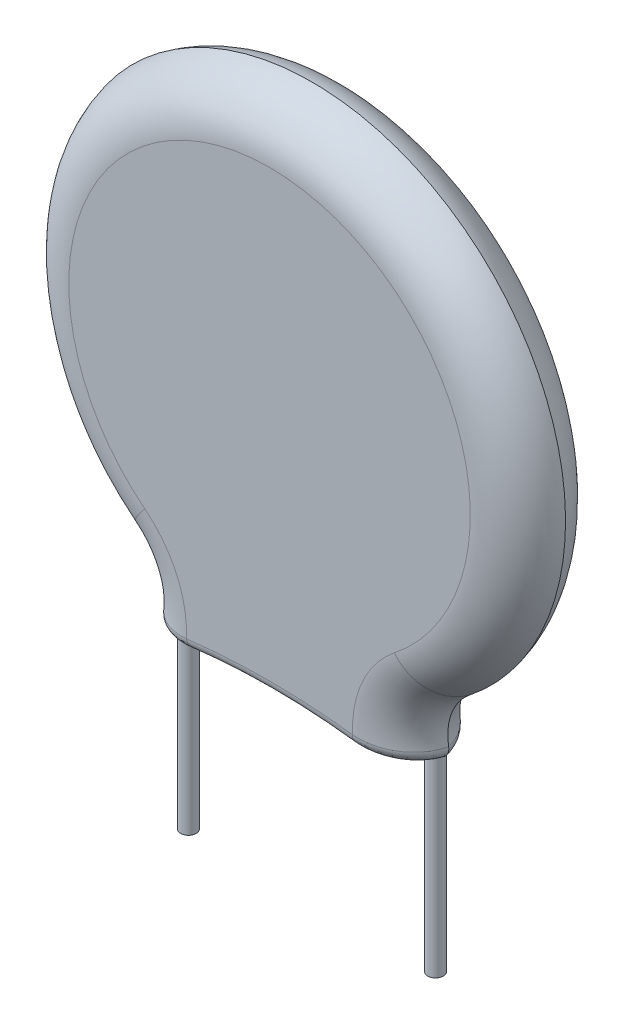
from build123d import *

# Parameters (mm, degrees)
BOSS_EXTRUDE1_DEPTH = 1.375
FILLET1_R           = 1.75
FILLET7_R           = 0.35
WRAP1_START         = -0.01
WRAP1_DEPTH         = 0.01


# Read off the part's stored shape, not the designer's step: Wrap1
with BuildPart() as part:
    # Sketch1 → Boss-Extrude1 (new, symmetric)
    with BuildSketch(Plane.XY):
        with BuildLine():
            ThreePointArc((4.65, -8.75), (4.475030194, -7.520172414), (5.127467489, -6.463093466))
            ThreePointArc((5.127467489, -6.463093466), (0, 8.25), (-5.127467489, -6.463093466))
            ThreePointArc((-5.127467489, -6.463093466), (-4.475030194, -7.520172414), (-4.65, -8.75))
            ThreePointArc((-4.65, -8.75), (0, -8.25), (4.65, -8.75))
        make_face()
    extrude(amount=BOSS_EXTRUDE1_DEPTH, both=True)

    # Fillet1
    # the kernel refuses this fillet: 1.75 mm, written as the material it takes off along each edge
    with BuildSketch(Plane(origin=(-6.262102122, -7.893282872, -1.375), x_dir=(0.6215112107703308, 0.7834052686105688, 0), z_dir=(-0.7834052686105688, 0.6215112107703308, 0))) as fillet1_piece_1:
        with BuildLine():
            CenterArc((1.825606061 + FILLET1_R, -FILLET1_R), FILLET1_R, 90, 90)
            Line((1.825606061 + FILLET1_R, 0), (1.825606061, 0))
            Line((1.825606061, 0), (1.825606061, -FILLET1_R))
        make_face()
    revolve(axis=Axis((-6.262102122, -7.893282872, -1.375), (0, 0, -1)), revolution_arc=216.911277343, mode=Mode.SUBTRACT)
    with BuildSketch(Plane(origin=(0, 0, -1.375), x_dir=(0.62151121077033, -0.7834052686105696, 0), z_dir=(-0.7834052686105696, -0.62151121077033, 0))) as fillet1_piece_2:
        with BuildLine():
            CenterArc((8.25 - FILLET1_R, FILLET1_R), FILLET1_R, 270, 90)
            Line((8.25 - FILLET1_R, 0), (8.25, 0))
            Line((8.25, 0), (8.25, FILLET1_R))
        make_face()
    revolve(axis=Axis((0, 0, -1.375), (0, 0, 1)), revolution_arc=283.146849467, mode=Mode.SUBTRACT)
    with BuildSketch(Plane(origin=(-6.262102122, -7.893282872, 1.375), x_dir=(0.6215112107703308, 0.7834052686105688, 0), z_dir=(-0.7834052686105688, 0.6215112107703308, 0))) as fillet1_piece_3:
        with BuildLine():
            CenterArc((1.825606061 + FILLET1_R, FILLET1_R), FILLET1_R, 180, 90)
            Line((1.825606061 + FILLET1_R, 0), (1.825606061, 0))
            Line((1.825606061, 0), (1.825606061, FILLET1_R))
        make_face()
    revolve(axis=Axis((-6.262102122, -7.893282872, 1.375), (0, 0, -1)), revolution_arc=216.911277343, mode=Mode.SUBTRACT)
    with BuildSketch(Plane(origin=(0, 0, 1.375), x_dir=(0.62151121077033, -0.7834052686105696, 0), z_dir=(-0.7834052686105696, -0.62151121077033, 0))) as fillet1_piece_4:
        with BuildLine():
            CenterArc((8.25 - FILLET1_R, -FILLET1_R), FILLET1_R, 0, 90)
            Line((8.25 - FILLET1_R, 0), (8.25, 0))
            Line((8.25, 0), (8.25, -FILLET1_R))
        make_face()
    revolve(axis=Axis((0, 0, 1.375), (0, 0, 1)), revolution_arc=283.146849467, mode=Mode.SUBTRACT)
    with BuildSketch(Plane(origin=(6.262102122, -7.893282872, -1.375), x_dir=(0.967435187537715, -0.25311886123690236, 0), z_dir=(0.25311886123690236, 0.967435187537715, 0))) as fillet1_piece_5:
        with BuildLine():
            CenterArc((1.825606061 + FILLET1_R, -FILLET1_R), FILLET1_R, 90, 90)
            Line((1.825606061 + FILLET1_R, 0), (1.825606061, 0))
            Line((1.825606061, 0), (1.825606061, -FILLET1_R))
        make_face()
    revolve(axis=Axis((6.262102122, -7.893282872, -1.375), (0, 0, -1)), revolution_arc=216.911277343, mode=Mode.SUBTRACT)
    with BuildSketch(Plane(origin=(6.262102122, -7.893282872, 1.375), x_dir=(0.967435187537715, -0.25311886123690236, 0), z_dir=(0.25311886123690236, 0.967435187537715, 0))) as fillet1_piece_6:
        with BuildLine():
            CenterArc((1.825606061 + FILLET1_R, FILLET1_R), FILLET1_R, 180, 90)
            Line((1.825606061 + FILLET1_R, 0), (1.825606061, 0))
            Line((1.825606061, 0), (1.825606061, FILLET1_R))
        make_face()
    revolve(axis=Axis((6.262102122, -7.893282872, 1.375), (0, 0, -1)), revolution_arc=216.911277343, mode=Mode.SUBTRACT)

    # Fillet7
    fillet7_edges = [part.edges().sort_by_distance(p)[0] for p in [
        (0, -8.25, -1.375),
        (0, -8.25, 1.375),
        (3.883166688, -8.597461727, 0.990381708),
        (3.883166674, -8.597461724, -0.99038172),
        (-3.883166688, -8.597461727, 0.990381708),
        (-3.883166674, -8.597461724, -0.99038172),
    ]]
    fillet(fillet7_edges, radius=FILLET7_R)

    # Wrap1 outline → Wrap1 (cut)
    with BuildSketch(Plane(origin=(0, 0, -1.375), x_dir=(-1, 0, 0), z_dir=(0, 0, -1)).offset(WRAP1_START)):
        with BuildLine():
            add(Edge.make_bspline(
                [(-3.174479167, 2.126488095), (-3.189079706, 2.119924738), (-3.222307124, 2.104988069), (-3.248395829, 2.079431092), (-3.263020833, 2.065104167)],
                knots=[0, 0, 0, 0, 0.439412387, 1, 1, 1, 1], degree=3))
            add(Edge.make_bspline(
                [(-3.263020833, 2.065104167), (-3.273868022, 2.054282726), (-3.298520353, 2.02968891), (-3.322267327, 2.004218576), (-3.335565476, 1.989955357)],
                knots=[0, 0, 0, 0, 0.440006596, 1, 1, 1, 1], degree=3))
            add(Edge.make_bspline(
                [(-3.335565476, 1.989955357), (-3.350436226, 1.960450992), (-3.384233327, 1.89339573), (-3.417424739, 1.826038469), (-3.436011905, 1.788318452)],
                knots=[0, 0, 0, 0, 0.440000746, 1, 1, 1, 1], degree=3))
            add(Edge.make_bspline(
                [(-3.436011905, 1.788318452), (-3.43617014, 1.780014779), (-3.436529756, 1.761143215), (-3.437867146, 1.742314647), (-3.438616071, 1.731770833)],
                knots=[0, 0, 0, 0, 0.44000979, 1, 1, 1, 1], degree=3))
            add(Edge.make_bspline(
                [(-3.438616071, 1.731770833), (-3.436660711, 1.728590381), (-3.432461242, 1.721759821), (-3.436472525, 1.714706596), (-3.438616071, 1.7109375)],
                knots=[0, 0, 0, 0, 0.465620921, 1, 1, 1, 1], degree=3))
            add(Edge.make_bspline(
                [(-3.438616071, 1.7109375), (-3.438384529, 1.695702167), (-3.437863353, 1.661409073), (-3.416586261, 1.634179794), (-3.404761905, 1.619047619)],
                knots=[0, 0, 0, 0, 0.444268247, 1, 1, 1, 1], degree=3))
            add(Edge.make_bspline(
                [(-3.404761905, 1.619047619), (-3.39815247, 1.61423703), (-3.38308415, 1.603269754), (-3.364325284, 1.602652855), (-3.353794643, 1.602306548)],
                knots=[0, 0, 0, 0, 0.438631212, 1, 1, 1, 1], degree=3))
            add(Edge.make_bspline(
                [(-3.353794643, 1.602306548), (-3.347484946, 1.602780717), (-3.33314409, 1.603858422), (-3.319195443, 1.607394645), (-3.311383929, 1.609375)],
                knots=[0, 0, 0, 0, 0.43998046, 1, 1, 1, 1], degree=3))
            add(Edge.make_bspline(
                [(-3.311383929, 1.609375), (-3.297321892, 1.617336647), (-3.265637802, 1.635275553), (-3.25750146, 1.671225565), (-3.25297619, 1.691220238)],
                knots=[0, 0, 0, 0, 0.443820123, 1, 1, 1, 1], degree=3))
            Line((-3.25297619, 1.691220238), (-3.25297619, 1.754092262))
            Line((-3.25297619, 1.754092262), (-3.178199405, 1.90327381))
            Line((-3.178199405, 1.90327381), (-3.115327381, 1.967261905))
            Line((-3.115327381, 1.967261905), (-2.978422619, 2.035714286))
            Line((-2.978422619, 2.035714286), (-2.673735119, 2.035714286))
            Line((-2.673735119, 2.035714286), (-2.522321429, 1.963169643))
            Line((-2.522321429, 1.963169643), (-2.45610119, 1.894717262))
            Line((-2.45610119, 1.894717262), (-2.380952381, 1.747395833))
            Line((-2.380952381, 1.747395833), (-2.380952381, 1.609002976))
            Line((-2.380952381, 1.609002976), (-2.452008929, 1.468005952))
            Line((-2.452008929, 1.468005952), (-2.622767857, 1.209449405))
            Line((-2.622767857, 1.209449405), (-3.493303571, 0.345982143))
            add(Edge.make_bspline(
                [(-3.493303571, 0.345982143), (-3.501187444, 0.33661479), (-3.519088983, 0.315344783), (-3.522115751, 0.287520063), (-3.523809524, 0.271949405)],
                knots=[0, 0, 0, 0, 0.440401981, 1, 1, 1, 1], degree=3))
            add(Edge.make_bspline(
                [(-3.523809524, 0.271949405), (-3.520952707, 0.257509703), (-3.514516978, 0.224980482), (-3.484149357, 0.210457302), (-3.467261905, 0.202380952)],
                knots=[0, 0, 0, 0, 0.443899416, 1, 1, 1, 1], degree=3))
            Line((-3.467261905, 0.202380952), (-2.203497024, 0.202380952))
            add(Edge.make_bspline(
                [(-2.203497024, 0.202380952), (-2.189655012, 0.203347759), (-2.158289795, 0.205538489), (-2.135500079, 0.227619229), (-2.122767857, 0.239955357)],
                knots=[0, 0, 0, 0, 0.441317253, 1, 1, 1, 1], degree=3))
            add(Edge.make_bspline(
                [(-2.122767857, 0.239955357), (-2.120307243, 0.246214055), (-2.114716931, 0.260433297), (-2.11081527, 0.275209684), (-2.108630952, 0.283482143)],
                knots=[0, 0, 0, 0, 0.440156891, 1, 1, 1, 1], degree=3))
            add(Edge.make_bspline(
                [(-2.108630952, 0.283482143), (-2.113216653, 0.302301232), (-2.123729868, 0.345446034), (-2.166411576, 0.360538341), (-2.19047619, 0.369047619)],
                knots=[0, 0, 0, 0, 0.436184375, 1, 1, 1, 1], degree=3))
            Line((-2.19047619, 0.369047619), (-3.26078869, 0.369047619))
            Line((-3.26078869, 0.369047619), (-2.480654762, 1.112723214))
            Line((-2.480654762, 1.112723214), (-2.288318452, 1.390252976))
            add(Edge.make_bspline(
                [(-2.288318452, 1.390252976), (-2.273910942, 1.418760785), (-2.241166538, 1.483551379), (-2.208672743, 1.548468043), (-2.19047619, 1.584821429)],
                knots=[0, 0, 0, 0, 0.439999186, 1, 1, 1, 1], degree=3))
            Line((-2.19047619, 1.584821429), (-2.19047619, 1.784598214))
            add(Edge.make_bspline(
                [(-2.19047619, 1.784598214), (-2.201182957, 1.806799702), (-2.225515863, 1.857256272), (-2.251227043, 1.907025599), (-2.265625, 1.934895833)],
                knots=[0, 0, 0, 0, 0.440011819, 1, 1, 1, 1], degree=3))
            add(Edge.make_bspline(
                [(-2.265625, 1.934895833), (-2.281623835, 1.961948798), (-2.318155963, 2.023722196), (-2.372408524, 2.0709342), (-2.402901786, 2.097470238)],
                knots=[0, 0, 0, 0, 0.437938763, 1, 1, 1, 1], degree=3))
            add(Edge.make_bspline(
                [(-2.402901786, 2.097470238), (-2.434738765, 2.112189182), (-2.507094686, 2.145640935), (-2.578859624, 2.180343518), (-2.619047619, 2.199776786)],
                knots=[0, 0, 0, 0, 0.440005163, 1, 1, 1, 1], degree=3))
            Line((-2.619047619, 2.199776786), (-3.006696429, 2.202380952))
            Line((-3.006696429, 2.202380952), (-3.026041667, 2.197916667))
            Line((-3.026041667, 2.197916667), (-3.174479167, 2.126488095))
        make_face()
        with BuildLine():
            Line((0.928571429, -0.395089286), (1.640997024, -2.248139881))
            add(Edge.make_bspline(
                [(1.640997024, -2.248139881), (1.647308346, -2.260858798), (1.66156507, -2.289589717), (1.693746528, -2.294745617), (1.711681548, -2.297619048)],
                knots=[0, 0, 0, 0, 0.44269091, 1, 1, 1, 1], degree=3))
            add(Edge.make_bspline(
                [(1.711681548, -2.297619048), (1.72906646, -2.296816711), (1.768297032, -2.295006168), (1.795972668, -2.26657566), (1.811383929, -2.250744048)],
                knots=[0, 0, 0, 0, 0.443147037, 1, 1, 1, 1], degree=3))
            Line((1.811383929, -2.250744048), (2.523809524, -0.389136905))
            add(Edge.make_bspline(
                [(2.523809524, -0.389136905), (2.52360421, -0.382404249), (2.523138145, -0.367121051), (2.519036072, -0.352373106), (2.516741071, -0.344122024)],
                knots=[0, 0, 0, 0, 0.44052667, 1, 1, 1, 1], degree=3))
            add(Edge.make_bspline(
                [(2.516741071, -0.344122024), (2.505579268, -0.332673805), (2.4801106, -0.306551605), (2.443774609, -0.300832), (2.423363095, -0.297619048)],
                knots=[0, 0, 0, 0, 0.438256296, 1, 1, 1, 1], degree=3))
            add(Edge.make_bspline(
                [(2.423363095, -0.297619048), (2.411382539, -0.300012814), (2.384263898, -0.305431236), (2.364709974, -0.32524766), (2.353794643, -0.336309524)],
                knots=[0, 0, 0, 0, 0.441783061, 1, 1, 1, 1], degree=3))
            Line((2.353794643, -0.336309524), (1.725074405, -2.045386905))
            Line((1.725074405, -2.045386905), (1.102678571, -0.345610119))
            add(Edge.make_bspline(
                [(1.102678571, -0.345610119), (1.091119569, -0.334433258), (1.064831844, -0.309014607), (1.028764617, -0.301711114), (1.008556548, -0.297619048)],
                knots=[0, 0, 0, 0, 0.43971102, 1, 1, 1, 1], degree=3))
            add(Edge.make_bspline(
                [(1.008556548, -0.297619048), (0.998432776, -0.299407741), (0.975385693, -0.303479756), (0.956593816, -0.317601996), (0.946056548, -0.325520833)],
                knots=[0, 0, 0, 0, 0.439264753, 1, 1, 1, 1], degree=3))
            add(Edge.make_bspline(
                [(0.946056548, -0.325520833), (0.940937244, -0.334997611), (0.929270063, -0.356595722), (0.928822571, -0.381251771), (0.928571429, -0.395089286)],
                knots=[0, 0, 0, 0, 0.438778094, 1, 1, 1, 1], degree=3))
        make_face()
        with BuildLine():
            Line((-0.785714286, -1.449032738), (-0.785714286, -0.366815476))
            add(Edge.make_bspline(
                [(-0.785714286, -0.366815476), (-0.79519786, -0.348256433), (-0.81696731, -0.305654339), (-0.865478957, -0.300517877), (-0.892857143, -0.297619048)],
                knots=[0, 0, 0, 0, 0.435636873, 1, 1, 1, 1], degree=3))
            add(Edge.make_bspline(
                [(-0.892857143, -0.297619048), (-0.911346879, -0.298688184), (-0.95268093, -0.301078252), (-0.967822244, -0.340541064), (-0.976190476, -0.36235119)],
                knots=[0, 0, 0, 0, 0.447324562, 1, 1, 1, 1], degree=3))
            Line((-0.976190476, -0.36235119), (-0.976190476, -2.226190476))
            add(Edge.make_bspline(
                [(-0.976190476, -2.226190476), (-0.971803093, -2.24485099), (-0.961827502, -2.287279393), (-0.917621065, -2.293906577), (-0.892857143, -2.297619048)],
                knots=[0, 0, 0, 0, 0.439811847, 1, 1, 1, 1], degree=3))
            Line((-0.892857143, -2.297619048), (-0.858630952, -2.297619048))
            add(Edge.make_bspline(
                [(-0.858630952, -2.297619048), (-0.844546159, -2.291434274), (-0.812777933, -2.277484526), (-0.795391983, -2.247161639), (-0.785714286, -2.230282738)],
                knots=[0, 0, 0, 0, 0.443361007, 1, 1, 1, 1], degree=3))
            Line((-0.785714286, -2.230282738), (-0.785714286, -1.632440476))
            Line((-0.785714286, -1.632440476), (-0.450892857, -1.27827381))
            Line((-0.450892857, -1.27827381), (0.269717262, -2.261904762))
            add(Edge.make_bspline(
                [(0.269717262, -2.261904762), (0.27971902, -2.271965965), (0.302506095, -2.294888472), (0.335122363, -2.296637633), (0.353422619, -2.297619048)],
                knots=[0, 0, 0, 0, 0.438922434, 1, 1, 1, 1], degree=3))
            add(Edge.make_bspline(
                [(0.353422619, -2.297619048), (0.373175408, -2.293671513), (0.417098243, -2.284893668), (0.431698081, -2.241748217), (0.439732143, -2.218005952)],
                knots=[0, 0, 0, 0, 0.449715703, 1, 1, 1, 1], degree=3))
            add(Edge.make_bspline(
                [(0.439732143, -2.218005952), (0.438538582, -2.21290242), (0.435827168, -2.201308713), (0.430221432, -2.190786297), (0.427083333, -2.184895833)],
                knots=[0, 0, 0, 0, 0.440198566, 1, 1, 1, 1], degree=3))
            Line((0.427083333, -2.184895833), (-0.335193452, -1.171502976))
            Line((-0.335193452, -1.171502976), (0.366071429, -0.474702381))
            Line((0.366071429, -0.474702381), (0.42671131, -0.411830357))
            add(Edge.make_bspline(
                [(0.42671131, -0.411830357), (0.429907307, -0.407239301), (0.437135694, -0.396855711), (0.438802376, -0.384259178), (0.439732143, -0.377232143)],
                knots=[0, 0, 0, 0, 0.442145323, 1, 1, 1, 1], degree=3))
            add(Edge.make_bspline(
                [(0.439732143, -0.377232143), (0.438690898, -0.370352545), (0.436322271, -0.354702812), (0.428732491, -0.340769538), (0.424479167, -0.33296131)],
                knots=[0, 0, 0, 0, 0.439598435, 1, 1, 1, 1], degree=3))
            add(Edge.make_bspline(
                [(0.424479167, -0.33296131), (0.415672627, -0.324532905), (0.395634579, -0.305355252), (0.36810766, -0.300636163), (0.352678571, -0.297991071)],
                knots=[0, 0, 0, 0, 0.439490913, 1, 1, 1, 1], degree=3))
            add(Edge.make_bspline(
                [(0.352678571, -0.297991071), (0.342905489, -0.297906513), (0.320798852, -0.297715242), (0.300427769, -0.306488965), (0.2890625, -0.311383929)],
                knots=[0, 0, 0, 0, 0.442088143, 1, 1, 1, 1], degree=3))
            Line((0.2890625, -0.311383929), (-0.785714286, -1.449032738))
        make_face()
        with BuildLine():
            add(Edge.make_bspline(
                [(-1.364955357, 2.126488095), (-1.379555896, 2.119924738), (-1.412783314, 2.104988069), (-1.438872019, 2.079431092), (-1.453497024, 2.065104167)],
                knots=[0, 0, 0, 0, 0.439412387, 1, 1, 1, 1], degree=3))
            add(Edge.make_bspline(
                [(-1.453497024, 2.065104167), (-1.464344212, 2.054282726), (-1.488996543, 2.02968891), (-1.512743518, 2.004218576), (-1.526041667, 1.989955357)],
                knots=[0, 0, 0, 0, 0.440006596, 1, 1, 1, 1], degree=3))
            add(Edge.make_bspline(
                [(-1.526041667, 1.989955357), (-1.540912416, 1.960450992), (-1.574709517, 1.89339573), (-1.607900929, 1.826038469), (-1.626488095, 1.788318452)],
                knots=[0, 0, 0, 0, 0.440000746, 1, 1, 1, 1], degree=3))
            add(Edge.make_bspline(
                [(-1.626488095, 1.788318452), (-1.62664633, 1.780014779), (-1.627005947, 1.761143215), (-1.628343337, 1.742314647), (-1.629092262, 1.731770833)],
                knots=[0, 0, 0, 0, 0.44000979, 1, 1, 1, 1], degree=3))
            add(Edge.make_bspline(
                [(-1.629092262, 1.731770833), (-1.627136901, 1.728590381), (-1.622937432, 1.721759821), (-1.626948716, 1.714706596), (-1.629092262, 1.7109375)],
                knots=[0, 0, 0, 0, 0.465620921, 1, 1, 1, 1], degree=3))
            add(Edge.make_bspline(
                [(-1.629092262, 1.7109375), (-1.62886072, 1.695702167), (-1.628339543, 1.661409073), (-1.607062451, 1.634179794), (-1.595238095, 1.619047619)],
                knots=[0, 0, 0, 0, 0.444268247, 1, 1, 1, 1], degree=3))
            add(Edge.make_bspline(
                [(-1.595238095, 1.619047619), (-1.58862866, 1.61423703), (-1.57356034, 1.603269754), (-1.554801475, 1.602652855), (-1.544270833, 1.602306548)],
                knots=[0, 0, 0, 0, 0.438631212, 1, 1, 1, 1], degree=3))
            add(Edge.make_bspline(
                [(-1.544270833, 1.602306548), (-1.537961137, 1.602780717), (-1.52362028, 1.603858422), (-1.509671634, 1.607394645), (-1.501860119, 1.609375)],
                knots=[0, 0, 0, 0, 0.43998046, 1, 1, 1, 1], degree=3))
            add(Edge.make_bspline(
                [(-1.501860119, 1.609375), (-1.487798083, 1.617336647), (-1.456113993, 1.635275553), (-1.447977651, 1.671225565), (-1.443452381, 1.691220238)],
                knots=[0, 0, 0, 0, 0.443820123, 1, 1, 1, 1], degree=3))
            Line((-1.443452381, 1.691220238), (-1.443452381, 1.754092262))
            Line((-1.443452381, 1.754092262), (-1.368675595, 1.90327381))
            Line((-1.368675595, 1.90327381), (-1.305803571, 1.967261905))
            Line((-1.305803571, 1.967261905), (-1.16889881, 2.035714286))
            Line((-1.16889881, 2.035714286), (-0.86421131, 2.035714286))
            Line((-0.86421131, 2.035714286), (-0.712797619, 1.963169643))
            Line((-0.712797619, 1.963169643), (-0.646577381, 1.894717262))
            Line((-0.646577381, 1.894717262), (-0.571428571, 1.747395833))
            Line((-0.571428571, 1.747395833), (-0.571428571, 1.609002976))
            Line((-0.571428571, 1.609002976), (-0.642485119, 1.468005952))
            Line((-0.642485119, 1.468005952), (-0.813244048, 1.209449405))
            Line((-0.813244048, 1.209449405), (-1.683779762, 0.345982143))
            add(Edge.make_bspline(
                [(-1.683779762, 0.345982143), (-1.691663635, 0.33661479), (-1.709565174, 0.315344783), (-1.712591941, 0.287520063), (-1.714285714, 0.271949405)],
                knots=[0, 0, 0, 0, 0.440401981, 1, 1, 1, 1], degree=3))
            add(Edge.make_bspline(
                [(-1.714285714, 0.271949405), (-1.711428898, 0.257509703), (-1.704993168, 0.224980482), (-1.674625547, 0.210457302), (-1.657738095, 0.202380952)],
                knots=[0, 0, 0, 0, 0.443899416, 1, 1, 1, 1], degree=3))
            Line((-1.657738095, 0.202380952), (-0.393973214, 0.202380952))
            add(Edge.make_bspline(
                [(-0.393973214, 0.202380952), (-0.380131203, 0.203347759), (-0.348765985, 0.205538489), (-0.325976269, 0.227619229), (-0.313244048, 0.239955357)],
                knots=[0, 0, 0, 0, 0.441317253, 1, 1, 1, 1], degree=3))
            add(Edge.make_bspline(
                [(-0.313244048, 0.239955357), (-0.310783433, 0.246214055), (-0.305193121, 0.260433297), (-0.301291461, 0.275209684), (-0.299107143, 0.283482143)],
                knots=[0, 0, 0, 0, 0.440156891, 1, 1, 1, 1], degree=3))
            add(Edge.make_bspline(
                [(-0.299107143, 0.283482143), (-0.303692843, 0.302301232), (-0.314206058, 0.345446034), (-0.356887767, 0.360538341), (-0.380952381, 0.369047619)],
                knots=[0, 0, 0, 0, 0.436184375, 1, 1, 1, 1], degree=3))
            Line((-0.380952381, 0.369047619), (-1.451264881, 0.369047619))
            Line((-1.451264881, 0.369047619), (-0.671130952, 1.112723214))
            Line((-0.671130952, 1.112723214), (-0.478794643, 1.390252976))
            add(Edge.make_bspline(
                [(-0.478794643, 1.390252976), (-0.464387132, 1.418760785), (-0.431642729, 1.483551379), (-0.399148933, 1.548468043), (-0.380952381, 1.584821429)],
                knots=[0, 0, 0, 0, 0.439999186, 1, 1, 1, 1], degree=3))
            Line((-0.380952381, 1.584821429), (-0.380952381, 1.784598214))
            add(Edge.make_bspline(
                [(-0.380952381, 1.784598214), (-0.391659147, 1.806799702), (-0.415992053, 1.857256272), (-0.441703233, 1.907025599), (-0.45610119, 1.934895833)],
                knots=[0, 0, 0, 0, 0.440011819, 1, 1, 1, 1], degree=3))
            add(Edge.make_bspline(
                [(-0.45610119, 1.934895833), (-0.472100025, 1.961948798), (-0.508632154, 2.023722196), (-0.562884715, 2.0709342), (-0.593377976, 2.097470238)],
                knots=[0, 0, 0, 0, 0.437938763, 1, 1, 1, 1], degree=3))
            add(Edge.make_bspline(
                [(-0.593377976, 2.097470238), (-0.625214955, 2.112189182), (-0.697570876, 2.145640935), (-0.769335815, 2.180343518), (-0.80952381, 2.199776786)],
                knots=[0, 0, 0, 0, 0.440005163, 1, 1, 1, 1], degree=3))
            Line((-0.80952381, 2.199776786), (-1.197172619, 2.202380952))
            Line((-1.197172619, 2.202380952), (-1.216517857, 2.197916667))
            Line((-1.216517857, 2.197916667), (-1.364955357, 2.126488095))
        make_face()
        with BuildLine():
            Line((0.285714286, 1.314732143), (0.285714286, 1.514136905))
            add(Edge.make_bspline(
                [(0.285714286, 1.514136905), (0.282288668, 1.523140345), (0.274456352, 1.543725771), (0.257853291, 1.558359105), (0.248511905, 1.566592262)],
                knots=[0, 0, 0, 0, 0.43736965, 1, 1, 1, 1], degree=3))
            add(Edge.make_bspline(
                [(0.248511905, 1.566592262), (0.238932661, 1.57156837), (0.217114675, 1.582902109), (0.192422461, 1.583178367), (0.178571429, 1.583333333)],
                knots=[0, 0, 0, 0, 0.439052626, 1, 1, 1, 1], degree=3))
            add(Edge.make_bspline(
                [(0.178571429, 1.583333333), (0.160081692, 1.582264197), (0.118747641, 1.579874129), (0.103606327, 1.540411317), (0.095238095, 1.51860119)],
                knots=[0, 0, 0, 0, 0.447324562, 1, 1, 1, 1], degree=3))
            Line((0.095238095, 1.51860119), (0.095238095, 0.273809524))
            add(Edge.make_bspline(
                [(0.095238095, 0.273809524), (0.099625478, 0.25514901), (0.109601069, 0.212720607), (0.153807506, 0.206093423), (0.178571429, 0.202380952)],
                knots=[0, 0, 0, 0, 0.439811847, 1, 1, 1, 1], degree=3))
            Line((0.178571429, 0.202380952), (0.212797619, 0.202380952))
            add(Edge.make_bspline(
                [(0.212797619, 0.202380952), (0.226717323, 0.208524845), (0.258125426, 0.222387784), (0.275846811, 0.252072432), (0.285714286, 0.26860119)],
                knots=[0, 0, 0, 0, 0.443188324, 1, 1, 1, 1], degree=3))
            Line((0.285714286, 0.26860119), (0.285714286, 1.123511905))
            Line((0.285714286, 1.123511905), (0.513020833, 1.347842262))
            Line((0.513020833, 1.347842262), (0.652529762, 1.416666667))
            Line((0.652529762, 1.416666667), (0.875, 1.416666667))
            Line((0.875, 1.416666667), (1.004092262, 1.352306548))
            Line((1.004092262, 1.352306548), (1.080357143, 1.141369048))
            Line((1.080357143, 1.141369048), (1.08296131, 0.27046131))
            add(Edge.make_bspline(
                [(1.08296131, 0.27046131), (1.090447465, 0.249964434), (1.107636184, 0.202902217), (1.159160163, 0.202569028), (1.188244048, 0.202380952)],
                knots=[0, 0, 0, 0, 0.435527199, 1, 1, 1, 1], degree=3))
            add(Edge.make_bspline(
                [(1.188244048, 0.202380952), (1.202714044, 0.206592228), (1.235009967, 0.215991471), (1.252099867, 0.245335904), (1.261532738, 0.261532738)],
                knots=[0, 0, 0, 0, 0.448044066, 1, 1, 1, 1], degree=3))
            Line((1.261532738, 0.261532738), (1.261904762, 1.163318452))
            add(Edge.make_bspline(
                [(1.261904762, 1.163318452), (1.251652485, 1.191048087), (1.231148098, 1.246506902), (1.201551834, 1.330114523), (1.181767211, 1.385832013), (1.171875, 1.413690476)],
                knots=[0, 0, 0, 0, 0.333339212, 0.666672978, 1, 1, 1, 1], degree=3))
            add(Edge.make_bspline(
                [(1.171875, 1.413690476), (1.167997438, 1.427227358), (1.159191382, 1.457970007), (1.131067501, 1.473945747), (1.115327381, 1.482886905)],
                knots=[0, 0, 0, 0, 0.440329044, 1, 1, 1, 1], degree=3))
            Line((1.115327381, 1.482886905), (0.918526786, 1.579985119))
            Line((0.918526786, 1.579985119), (0.613839286, 1.58296131))
            Line((0.613839286, 1.58296131), (0.596354167, 1.578869048))
            Line((0.596354167, 1.578869048), (0.3984375, 1.483630952))
            Line((0.3984375, 1.483630952), (0.285714286, 1.314732143))
        make_face()
        with BuildLine():
            Line((1.916666667, 0.202380952), (1.950892857, 0.202380952))
            add(Edge.make_bspline(
                [(1.950892857, 0.202380952), (1.964812561, 0.208524845), (1.996220664, 0.222387784), (2.013942049, 0.252072432), (2.023809524, 0.26860119)],
                knots=[0, 0, 0, 0, 0.443188324, 1, 1, 1, 1], degree=3))
            Line((2.023809524, 0.26860119), (2.023809524, 1.154761905))
            Line((2.023809524, 1.154761905), (2.62983631, 1.154761905))
            add(Edge.make_bspline(
                [(2.62983631, 1.154761905), (2.642909556, 1.15654097), (2.672634586, 1.160586082), (2.694323317, 1.181651603), (2.706473214, 1.193452381)],
                knots=[0, 0, 0, 0, 0.439805989, 1, 1, 1, 1], degree=3))
            add(Edge.make_bspline(
                [(2.706473214, 1.193452381), (2.710355516, 1.200153845), (2.719141393, 1.215319654), (2.721039078, 1.232802175), (2.722098214, 1.242559524)],
                knots=[0, 0, 0, 0, 0.441879805, 1, 1, 1, 1], degree=3))
            add(Edge.make_bspline(
                [(2.722098214, 1.242559524), (2.717481108, 1.259003585), (2.706905293, 1.29666989), (2.670459928, 1.312506043), (2.649925595, 1.321428571)],
                knots=[0, 0, 0, 0, 0.436572178, 1, 1, 1, 1], degree=3))
            Line((2.649925595, 1.321428571), (2.023809524, 1.321428571))
            Line((2.023809524, 1.321428571), (2.023809524, 2.035714286))
            Line((2.023809524, 2.035714286), (3.052455357, 2.035714286))
            add(Edge.make_bspline(
                [(3.052455357, 2.035714286), (3.063126766, 2.035645542), (3.087177718, 2.035490608), (3.108611887, 2.046630346), (3.120535714, 2.052827381)],
                knots=[0, 0, 0, 0, 0.443700072, 1, 1, 1, 1], degree=3))
            add(Edge.make_bspline(
                [(3.120535714, 2.052827381), (3.13115188, 2.062238387), (3.155219877, 2.083574157), (3.158744398, 2.115875208), (3.160714286, 2.133928571)],
                knots=[0, 0, 0, 0, 0.441090537, 1, 1, 1, 1], degree=3))
            add(Edge.make_bspline(
                [(3.160714286, 2.133928571), (3.154633366, 2.14847796), (3.140676199, 2.181872289), (3.105684092, 2.193080049), (3.0859375, 2.199404762)],
                knots=[0, 0, 0, 0, 0.435684404, 1, 1, 1, 1], degree=3))
            Line((3.0859375, 2.199404762), (1.899925595, 2.202380952))
            add(Edge.make_bspline(
                [(1.899925595, 2.202380952), (1.88676116, 2.198115428), (1.857049129, 2.188488173), (1.841816744, 2.160852509), (1.833333333, 2.14546131)],
                knots=[0, 0, 0, 0, 0.443067479, 1, 1, 1, 1], degree=3))
            Line((1.833333333, 2.14546131), (1.833333333, 0.273809524))
            add(Edge.make_bspline(
                [(1.833333333, 0.273809524), (1.837720716, 0.25514901), (1.847696307, 0.212720607), (1.891902744, 0.206093423), (1.916666667, 0.202380952)],
                knots=[0, 0, 0, 0, 0.439811847, 1, 1, 1, 1], degree=3))
        make_face()
        with BuildLine():
            add(Edge.make_bspline(
                [(-2.436383929, -0.373511905), (-2.450984468, -0.380075262), (-2.484211886, -0.395011931), (-2.51030059, -0.420568908), (-2.524925595, -0.434895833)],
                knots=[0, 0, 0, 0, 0.439412387, 1, 1, 1, 1], degree=3))
            add(Edge.make_bspline(
                [(-2.524925595, -0.434895833), (-2.535772784, -0.445717274), (-2.560425115, -0.47031109), (-2.584172089, -0.495781424), (-2.597470238, -0.510044643)],
                knots=[0, 0, 0, 0, 0.440006596, 1, 1, 1, 1], degree=3))
            add(Edge.make_bspline(
                [(-2.597470238, -0.510044643), (-2.612340988, -0.539549008), (-2.646138089, -0.60660427), (-2.679329501, -0.673961531), (-2.697916667, -0.711681548)],
                knots=[0, 0, 0, 0, 0.440000746, 1, 1, 1, 1], degree=3))
            add(Edge.make_bspline(
                [(-2.697916667, -0.711681548), (-2.698074902, -0.719985221), (-2.698434518, -0.738856785), (-2.699771908, -0.757685353), (-2.700520833, -0.768229167)],
                knots=[0, 0, 0, 0, 0.44000979, 1, 1, 1, 1], degree=3))
            add(Edge.make_bspline(
                [(-2.700520833, -0.768229167), (-2.698565473, -0.771409619), (-2.694366004, -0.778240179), (-2.698377287, -0.785293404), (-2.700520833, -0.7890625)],
                knots=[0, 0, 0, 0, 0.465620921, 1, 1, 1, 1], degree=3))
            add(Edge.make_bspline(
                [(-2.700520833, -0.7890625), (-2.700289291, -0.804297833), (-2.699768115, -0.838590927), (-2.678491022, -0.865820206), (-2.666666667, -0.880952381)],
                knots=[0, 0, 0, 0, 0.444268247, 1, 1, 1, 1], degree=3))
            add(Edge.make_bspline(
                [(-2.666666667, -0.880952381), (-2.660057231, -0.88576297), (-2.644988912, -0.896730246), (-2.626230046, -0.897347145), (-2.615699405, -0.897693452)],
                knots=[0, 0, 0, 0, 0.438631212, 1, 1, 1, 1], degree=3))
            add(Edge.make_bspline(
                [(-2.615699405, -0.897693452), (-2.609389708, -0.897219283), (-2.595048852, -0.896141578), (-2.581100205, -0.892605355), (-2.57328869, -0.890625)],
                knots=[0, 0, 0, 0, 0.43998046, 1, 1, 1, 1], degree=3))
            add(Edge.make_bspline(
                [(-2.57328869, -0.890625), (-2.559226654, -0.882663353), (-2.527542564, -0.864724447), (-2.519406222, -0.828774435), (-2.514880952, -0.808779762)],
                knots=[0, 0, 0, 0, 0.443820123, 1, 1, 1, 1], degree=3))
            Line((-2.514880952, -0.808779762), (-2.514880952, -0.745907738))
            Line((-2.514880952, -0.745907738), (-2.440104167, -0.59672619))
            Line((-2.440104167, -0.59672619), (-2.377232143, -0.532738095))
            Line((-2.377232143, -0.532738095), (-2.240327381, -0.464285714))
            Line((-2.240327381, -0.464285714), (-1.935639881, -0.464285714))
            Line((-1.935639881, -0.464285714), (-1.78422619, -0.536830357))
            Line((-1.78422619, -0.536830357), (-1.718005952, -0.605282738))
            Line((-1.718005952, -0.605282738), (-1.642857143, -0.752604167))
            Line((-1.642857143, -0.752604167), (-1.642857143, -0.890997024))
            Line((-1.642857143, -0.890997024), (-1.71391369, -1.031994048))
            Line((-1.71391369, -1.031994048), (-1.884672619, -1.290550595))
            Line((-1.884672619, -1.290550595), (-2.755208333, -2.154017857))
            add(Edge.make_bspline(
                [(-2.755208333, -2.154017857), (-2.763092206, -2.16338521), (-2.780993745, -2.184655217), (-2.784020513, -2.212479937), (-2.785714286, -2.228050595)],
                knots=[0, 0, 0, 0, 0.440401981, 1, 1, 1, 1], degree=3))
            add(Edge.make_bspline(
                [(-2.785714286, -2.228050595), (-2.782857469, -2.242490297), (-2.77642174, -2.275019518), (-2.746054119, -2.289542698), (-2.729166667, -2.297619048)],
                knots=[0, 0, 0, 0, 0.443899416, 1, 1, 1, 1], degree=3))
            Line((-2.729166667, -2.297619048), (-1.465401786, -2.297619048))
            add(Edge.make_bspline(
                [(-1.465401786, -2.297619048), (-1.451559774, -2.296652241), (-1.420194557, -2.294461511), (-1.39740484, -2.272380771), (-1.384672619, -2.260044643)],
                knots=[0, 0, 0, 0, 0.441317253, 1, 1, 1, 1], degree=3))
            add(Edge.make_bspline(
                [(-1.384672619, -2.260044643), (-1.382212005, -2.253785945), (-1.376621693, -2.239566703), (-1.372720032, -2.224790316), (-1.370535714, -2.216517857)],
                knots=[0, 0, 0, 0, 0.440156891, 1, 1, 1, 1], degree=3))
            add(Edge.make_bspline(
                [(-1.370535714, -2.216517857), (-1.375121414, -2.197698768), (-1.38563463, -2.154553966), (-1.428316338, -2.139461659), (-1.452380952, -2.130952381)],
                knots=[0, 0, 0, 0, 0.436184375, 1, 1, 1, 1], degree=3))
            Line((-1.452380952, -2.130952381), (-2.522693452, -2.130952381))
            Line((-2.522693452, -2.130952381), (-1.742559524, -1.387276786))
            Line((-1.742559524, -1.387276786), (-1.550223214, -1.109747024))
            add(Edge.make_bspline(
                [(-1.550223214, -1.109747024), (-1.535815704, -1.081239215), (-1.5030713, -1.016448621), (-1.470577505, -0.951531957), (-1.452380952, -0.915178571)],
                knots=[0, 0, 0, 0, 0.439999186, 1, 1, 1, 1], degree=3))
            Line((-1.452380952, -0.915178571), (-1.452380952, -0.715401786))
            add(Edge.make_bspline(
                [(-1.452380952, -0.715401786), (-1.463087719, -0.693200298), (-1.487420625, -0.642743728), (-1.513131805, -0.592974401), (-1.527529762, -0.565104167)],
                knots=[0, 0, 0, 0, 0.440011819, 1, 1, 1, 1], degree=3))
            add(Edge.make_bspline(
                [(-1.527529762, -0.565104167), (-1.543528597, -0.538051202), (-1.580060725, -0.476277804), (-1.634313286, -0.4290658), (-1.664806548, -0.402529762)],
                knots=[0, 0, 0, 0, 0.437938763, 1, 1, 1, 1], degree=3))
            add(Edge.make_bspline(
                [(-1.664806548, -0.402529762), (-1.696643526, -0.387810818), (-1.768999448, -0.354359065), (-1.840764386, -0.319656482), (-1.880952381, -0.300223214)],
                knots=[0, 0, 0, 0, 0.440005163, 1, 1, 1, 1], degree=3))
            Line((-1.880952381, -0.300223214), (-2.26860119, -0.297619048))
            Line((-2.26860119, -0.297619048), (-2.287946429, -0.302083333))
            Line((-2.287946429, -0.302083333), (-2.436383929, -0.373511905))
        make_face()
    extrude(amount=WRAP1_DEPTH, mode=Mode.SUBTRACT)


with BuildPart() as body_2:
    # Sketch2 → Revolve1 (revolve)
    with BuildSketch(Plane.XY, mode=Mode.PRIVATE) as revolve1_sk:
        with BuildLine():
            Line((-4, -7.988835359), (-4, -14.738835359))
            Line((-4, -14.738835359), (-3.75, -14.738835359))
            Line((-3.75, -14.738835359), (-3.75, -8.228835359))
            ThreePointArc((-3.75, -8.228835359), (-3.820294373, -8.059129732), (-3.99, -7.988835359))
            Line((-3.99, -7.988835359), (-4, -7.988835359))
        make_face()
    revolve(revolve1_sk.sketch.rotate(Axis((-4, -7.988835359, 0), (0, -1, 0)), 180), axis=Axis((-4, -7.988835359, 0), (0, -1, 0)))


with BuildPart() as body_3:
    # Mirror2: mirrored copy
    add(body_2.part.mirror(Plane(origin=(0, 0, 0), x_dir=(0, 0, 1), z_dir=(1, 0, 0))))


solid = Compound([part.part, body_2.part, body_3.part])
